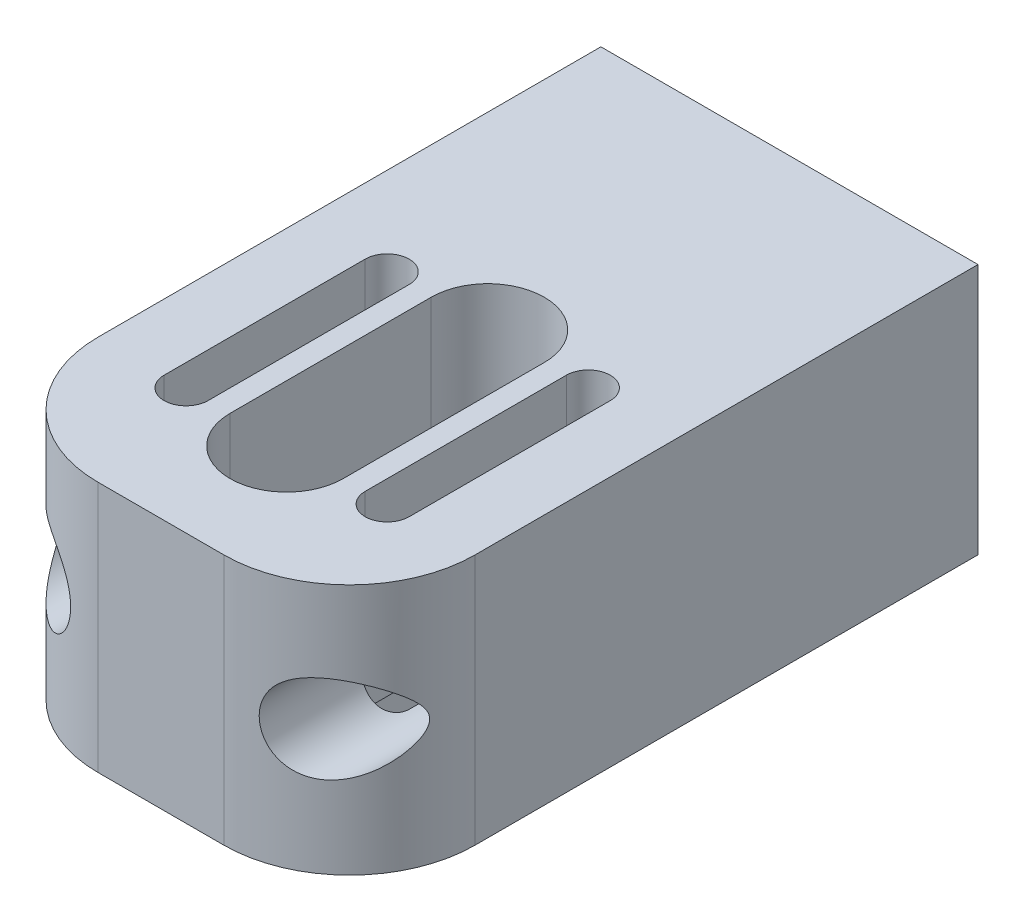
from build123d import *

# Parameters (mm, degrees)
SKETCH1_W                                           = 30
SKETCH1_H                                           = 20
BOSS_EXTRUDE1_DEPTH                                 = 50
CUT_EXTRUDE5_DEPTH                                  = 56.901917603
CUT_EXTRUDE2_DEPTH                                  = 20
SKETCH6_W                                           = 6
SKETCH6_H                                           = 22
CUT_EXTRUDE3_DEPTH                                  = 5
SKETCH7_R                                           = 1.75
CUT_EXTRUDE4_DEPTH                                  = 55.298200385
CBORE_FOR_M3_HEX_SOCKET_HEAD_CAP_SCREW1_D           = 3.4
CBORE_FOR_M3_HEX_SOCKET_HEAD_CAP_SCREW1_CBORE_D     = 7
CBORE_FOR_M3_HEX_SOCKET_HEAD_CAP_SCREW1_CBORE_DEPTH = 38.4
FILLET1_START                                       = -6
FILLET1_DEPTH                                       = 22


with BuildPart() as part:
    # Sketch1 → Boss-Extrude1 (new body)
    with BuildSketch(Plane.XY):
        with Locations((-0.000813035, 4.942227855)):
            Rectangle(SKETCH1_W, SKETCH1_H)
    extrude(amount=BOSS_EXTRUDE1_DEPTH)

    # Sketch3 → Cut-Extrude5 (cut, through all)
    with BuildSketch(Plane(origin=(0, 14.942227855, 0), x_dir=(1, 0, 0), z_dir=(0, 1, 0))):
        with BuildLine():
            Line((-4.500783142, -24.000000003), (-4.500176076, -40))
            ThreePointArc((-4.500176076, -40), (-0.000631376, -44.4995447), (4.498913324, -40))
            Line((4.498913324, -40), (4.498913324, -24.000000003))
            ThreePointArc((4.498913324, -24.000000003), (-0.000934909, -19.50015177), (-4.500783142, -24.000000003))
        make_face()
    extrude(amount=-CUT_EXTRUDE5_DEPTH, mode=Mode.SUBTRACT)

    # Sketch5 → Cut-Extrude2 (cut)
    with BuildSketch(Plane(origin=(0, 14.942227855, 0), x_dir=(1, 0, 0), z_dir=(0, 1, 0))):
        with BuildLine():
            Line((-9.751131515, -40), (-9.751131515, -24.000000003))
            ThreePointArc((-9.751131515, -24.000000003), (-8.000813035, -22.249681523), (-6.250494556, -24.000000003))
            Line((-6.250494556, -24.000000003), (-6.250494556, -40))
            ThreePointArc((-6.250494556, -40), (-8.000813035, -41.75031848), (-9.751131515, -40))
        make_face()
    cut_extrude2 = extrude(amount=-CUT_EXTRUDE2_DEPTH, mode=Mode.SUBTRACT)

    # Sketch6 → Cut-Extrude3 (cut)
    with BuildSketch(Plane.XZ.offset(5.057772145)):
        with Locations((-8.000813035, 32.000000001)):
            Rectangle(SKETCH6_W, SKETCH6_H)
    cut_extrude3 = extrude(amount=-CUT_EXTRUDE3_DEPTH, mode=Mode.SUBTRACT)

    # Sketch7 → Cut-Extrude4 (cut, through all)
    with BuildSketch(Plane.XY.offset(50)):
        with Locations((-11.000813035, 4.942227855)):
            Circle(SKETCH7_R)
    cut_extrude4 = extrude(amount=-CUT_EXTRUDE4_DEPTH, mode=Mode.SUBTRACT)

    # CBORE for M3 Hex Socket Head Cap Screw1 (through all)
    with Locations(Plane.XY.offset(50)):
        with Locations((-11.000813035, 4.942227855)):
            cbore_for_m3_hex_socket_head_cap_screw1 = CounterBoreHole(CBORE_FOR_M3_HEX_SOCKET_HEAD_CAP_SCREW1_D / 2, CBORE_FOR_M3_HEX_SOCKET_HEAD_CAP_SCREW1_CBORE_D / 2, CBORE_FOR_M3_HEX_SOCKET_HEAD_CAP_SCREW1_CBORE_DEPTH)

    # Fillet1: read off the stored shape, not the designer's step
    # Fillet1 outline → Fillet1 (cut)
    with BuildSketch(Plane(origin=(0, 0, 0), x_dir=(1, 0, 0), z_dir=(0, 1, 0)).offset(FILLET1_START)):
        with BuildLine():
            ThreePointArc((14.999186965, -40), (12.070254777, -47.071067812), (4.999186965, -50))
            Line((4.999186965, -50), (14.999186965, -50))
            Line((14.999186965, -50), (14.999186965, -40))
        make_face()
        with BuildLine():
            Line((-15.000813035, -50), (-5.000813035, -50))
            ThreePointArc((-5.000813035, -50), (-12.071880847, -47.071067812), (-15.000813035, -40))
            Line((-15.000813035, -40), (-15.000813035, -50))
        make_face()
    extrude(amount=FILLET1_DEPTH, mode=Mode.SUBTRACT)

    # Mirror1: Cut-Extrude2, Cut-Extrude3, Cut-Extrude4, CBORE for M3 Hex Socket Head Cap Screw1 across plane
    add(cut_extrude2.mirror(Plane(origin=(-0.000813035, 0, 0), x_dir=(0, 0, 1), z_dir=(1, 0, 0))), mode=Mode.SUBTRACT)
    add(cut_extrude3.mirror(Plane(origin=(-0.000813035, 0, 0), x_dir=(0, 0, 1), z_dir=(1, 0, 0))), mode=Mode.SUBTRACT)
    add(cut_extrude4.mirror(Plane(origin=(-0.000813035, 0, 0), x_dir=(0, 0, 1), z_dir=(1, 0, 0))), mode=Mode.SUBTRACT)
    add(cbore_for_m3_hex_socket_head_cap_screw1.mirror(Plane(origin=(-0.000813035, 0, 0), x_dir=(0, 0, 1), z_dir=(1, 0, 0))), mode=Mode.SUBTRACT)


solid = part.part
